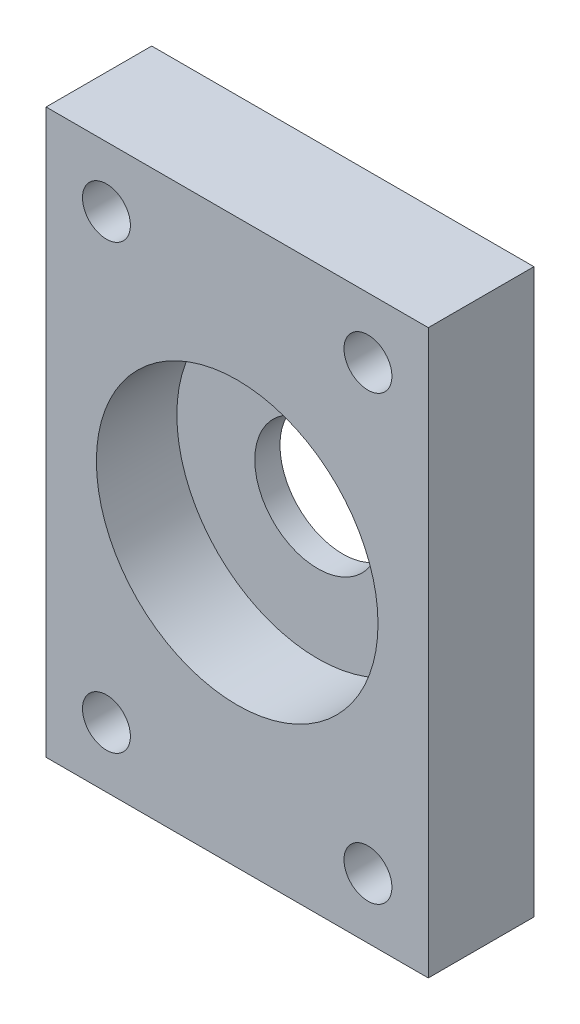
from build123d import *

# Parameters (mm, degrees)
CROQUIS1_R              = 18
CROQUIS1_R_2            = 14
SALIENTE_EXTRUIR1_DEPTH = 8
CROQUIS2_W              = 38
CROQUIS2_H              = 56
CROQUIS2_R              = 18
SALIENTE_EXTRUIR2_DEPTH = 8
CROQUIS5_W              = 38
CROQUIS5_H              = 56
CROQUIS5_R              = 6.25
SALIENTE_EXTRUIR3_DEPTH = 2.5
CROQUIS7_R              = 2.38125
CORTAR_EXTRUIR3_DEPTH   = 36.429507476


with BuildPart() as part:
    # Croquis1 → Saliente-Extruir1 (new body)
    with BuildSketch(Plane.XY):
        Circle(CROQUIS1_R)
        Circle(CROQUIS1_R_2, mode=Mode.SUBTRACT)
    extrude(amount=SALIENTE_EXTRUIR1_DEPTH)

    # Croquis2 → Saliente-Extruir2 (add)
    with BuildSketch(Plane(origin=(0, 0, 0), x_dir=(-1, 0, 0), z_dir=(0, 0, -1))):
        Rectangle(CROQUIS2_W, CROQUIS2_H)
        Circle(CROQUIS2_R, mode=Mode.SUBTRACT)
    extrude(amount=-SALIENTE_EXTRUIR2_DEPTH)

    # Croquis5 → Saliente-Extruir3 (add)
    with BuildSketch(Plane(origin=(0, 0, 0), x_dir=(-1, 0, 0), z_dir=(0, 0, -1))):
        Rectangle(CROQUIS5_W, CROQUIS5_H)
        Circle(CROQUIS5_R, mode=Mode.SUBTRACT)
    extrude(amount=SALIENTE_EXTRUIR3_DEPTH)

    # Croquis7 → Cortar-Extruir3 (cut, through all)
    with BuildSketch(Plane(origin=(0, 0, -2.5), x_dir=(-1, 0, 0), z_dir=(0, 0, -1))):
        with Locations((-13, 22)):
            Circle(CROQUIS7_R)
        with Locations((13, 22)):
            Circle(CROQUIS7_R)
        with Locations((13, -22)):
            Circle(CROQUIS7_R)
        with Locations((-13, -22)):
            Circle(CROQUIS7_R)
    extrude(amount=-CORTAR_EXTRUIR3_DEPTH, mode=Mode.SUBTRACT)


solid = part.part
